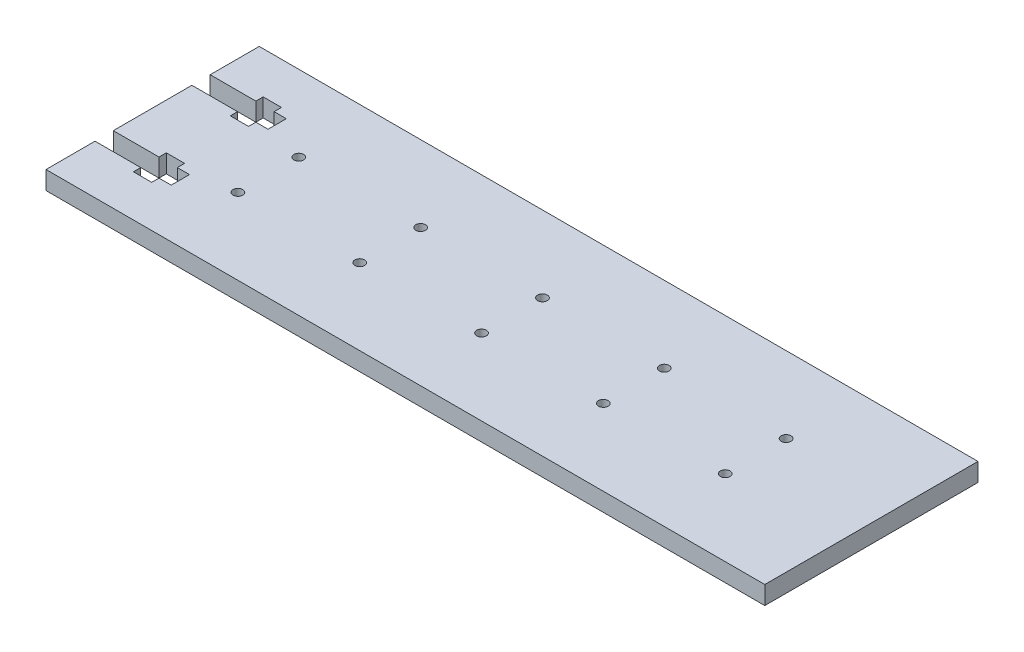
from build123d import *

# Parameters (mm, degrees)
SKETCH1_W           = 236
SKETCH1_H           = 70
SKETCH1_R           = 1.6
BOSS_EXTRUDE1_DEPTH = 6
CUT_EXTRUDE2_DEPTH  = 124.227432011


with BuildPart() as part:
    # Sketch1 → Boss-Extrude1 (new body)
    with BuildSketch(Plane(origin=(0, 0, 0), x_dir=(1, 0, 0), z_dir=(0, 1, 0))):
        Rectangle(SKETCH1_W, SKETCH1_H)
        with Locations((80, -10)):
            Circle(SKETCH1_R, mode=Mode.SUBTRACT)
        with Locations((80, 10)):
            Circle(SKETCH1_R, mode=Mode.SUBTRACT)
        with Locations((40, -10)):
            Circle(SKETCH1_R, mode=Mode.SUBTRACT)
        with Locations((40, 10)):
            Circle(SKETCH1_R, mode=Mode.SUBTRACT)
        with Locations((0, -10)):
            Circle(SKETCH1_R, mode=Mode.SUBTRACT)
        with Locations((0, 10)):
            Circle(SKETCH1_R, mode=Mode.SUBTRACT)
        with Locations((-40, -10)):
            Circle(SKETCH1_R, mode=Mode.SUBTRACT)
        with Locations((-40, 10)):
            Circle(SKETCH1_R, mode=Mode.SUBTRACT)
        with Locations((-80, -10)):
            Circle(SKETCH1_R, mode=Mode.SUBTRACT)
        with Locations((-80, 10)):
            Circle(SKETCH1_R, mode=Mode.SUBTRACT)
    extrude(amount=BOSS_EXTRUDE1_DEPTH)

    # Sketch3 → Cut-Extrude2 (cut, through all)
    with BuildSketch(Plane(origin=(0, 6, 0), x_dir=(1, 0, 0), z_dir=(0, 1, 0))):
        Polygon((-118, 12.9), (-103, 12.9), (-103, 10.5), (-97, 10.5), (-97, 12.9), (-93, 12.9), (-93, 18.9), (-97, 18.9), (-97, 21.3), (-103, 21.3), (-103, 18.9), (-118, 18.9), align=None)
        Polygon((-103, -18.9), (-103, -21.3), (-97, -21.3), (-97, -18.9), (-93, -18.9), (-93, -12.9), (-97, -12.9), (-97, -10.5), (-103, -10.5), (-103, -12.9), (-118, -12.9), (-118, -18.9), align=None)
    extrude(amount=-CUT_EXTRUDE2_DEPTH, mode=Mode.SUBTRACT)


solid = part.part
